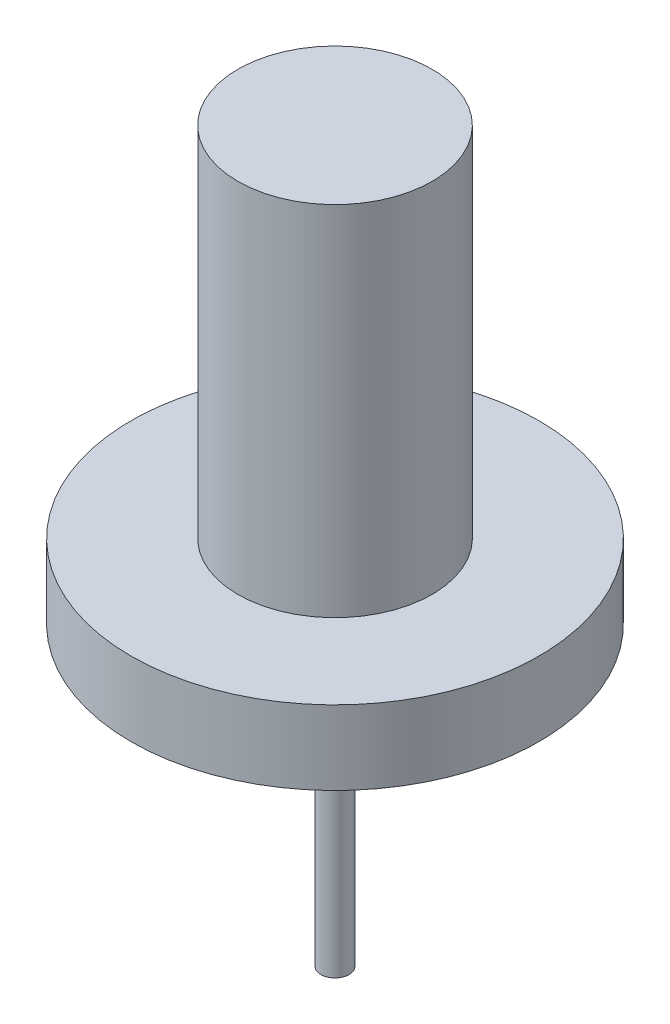
from build123d import *

# Parameters (mm, degrees)
SKETCH1_R      = 34.925
EXTRUDE1_DEPTH = 12.7
SKETCH2_R      = 16.637
EXTRUDE2_DEPTH = 61.2648
SKETCH3_R      = 2.40792343
EXTRUDE3_DEPTH = 50.8


with BuildPart() as part:
    # Sketch1 → Extrude1 (new body)
    with BuildSketch(Plane(origin=(0, 0, 0), x_dir=(1, 0, 0), z_dir=(0, 1, 0))):
        Circle(SKETCH1_R)
    extrude(amount=EXTRUDE1_DEPTH)

    # Sketch2 → Extrude2 (add)
    with BuildSketch(Plane(origin=(0, 12.7, 0), x_dir=(1, 0, 0), z_dir=(0, 1, 0))):
        Circle(SKETCH2_R)
    extrude(amount=EXTRUDE2_DEPTH)

    # Sketch3 → Extrude3 (add)
    with BuildSketch(Plane.XZ):
        Circle(SKETCH3_R)
    extrude(amount=EXTRUDE3_DEPTH)


solid = part.part
